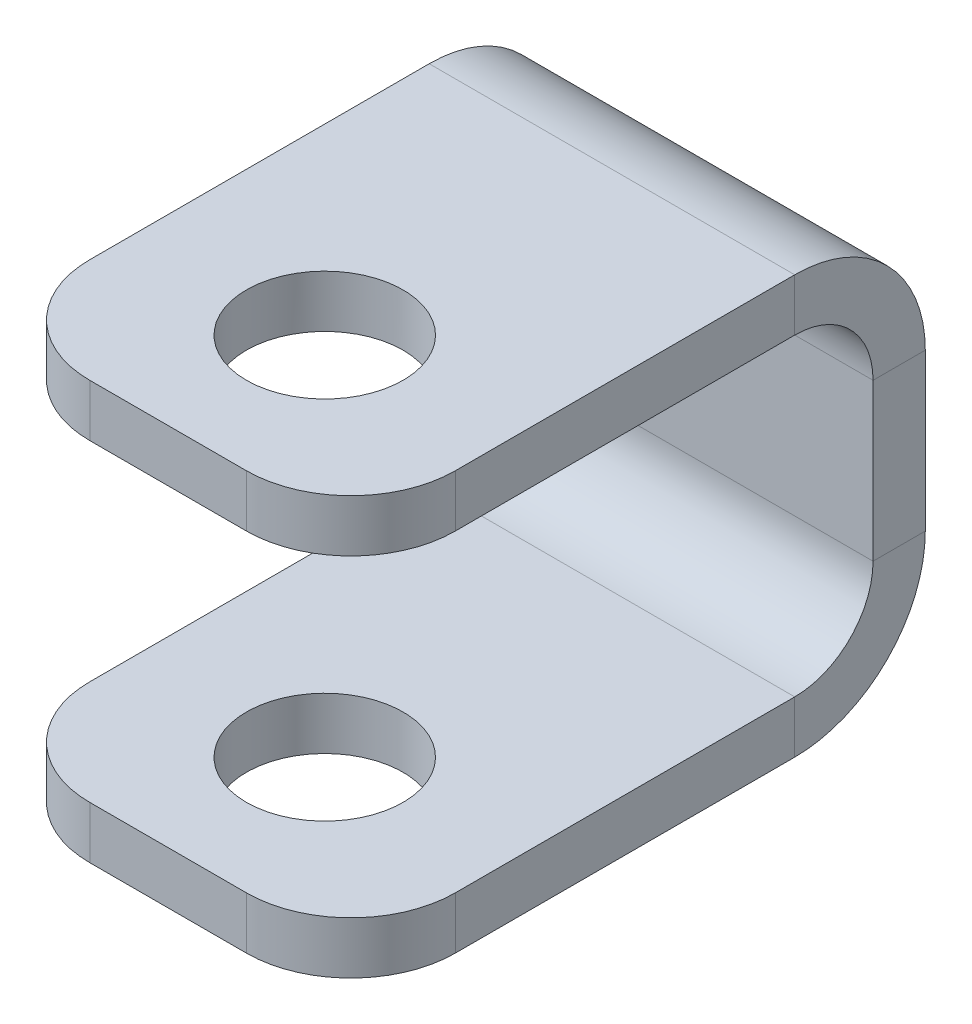
from build123d import *

# Parameters (mm, degrees)
SKETCH12_W                     = 22.225
SKETCH12_H                     = 25.4
BASE_FLANGE2_DEPTH             = 3.175
EDGE_FLANGE2_STRIP_W           = 22.225
EDGE_FLANGE2_STRIP_H           = 3.175
EDGE_FLANGE2_STRIP_CUT_DEPTH   = 22.225
EDGE_FLANGE2_STRIP_2_W         = 22.225
EDGE_FLANGE2_STRIP_2_H         = 3.175
EDGE_FLANGE2_STRIP_CUT_2_DEPTH = 22.225
EDGE_FLANGE2_DEPTH             = 22.225
EDGE_FLANGE2_BEND_DEPTH        = 22.225
CUT_EXTRUDE1_DEPTH             = 53.098064084
CUT_EXTRUDE1_DEPTH_BACK        = 53.098064084
SKETCH23_R                     = 4.7625
BREAK_CORNER1_START            = -12.7
BREAK_CORNER1_DEPTH            = 25.4


# Read off the part's stored shape, not the designer's step: Break-Corner1
# Sheet-metal steps are written as plain solids
with BuildPart() as part:
    # Sketch12 → Base-Flange2 (new body)
    with BuildSketch(Plane.XY):
        with Locations((25.4, 0)):
            Rectangle(SKETCH12_W, SKETCH12_H)
    extrude(amount=BASE_FLANGE2_DEPTH)

    # Edge-Flange2 strip (across the edge) → Edge-Flange2 strip cut (cut)
    with BuildSketch(Plane(origin=(36.5125, 12.7, 3.175), x_dir=(0, -1, 0), z_dir=(-1, 0, 0))):
        with Locations((-3.175, -1.5875)):
            Rectangle(EDGE_FLANGE2_STRIP_W, EDGE_FLANGE2_STRIP_H)
    extrude(amount=EDGE_FLANGE2_STRIP_CUT_DEPTH, mode=Mode.SUBTRACT)

    # Edge-Flange2 strip 2 (across the edge) → Edge-Flange2 strip cut 2 (cut)
    with BuildSketch(Plane(origin=(14.2875, -12.7, 3.175), x_dir=(0, 1, 0), z_dir=(1, 0, 0))):
        with Locations((-3.175, -1.5875)):
            Rectangle(EDGE_FLANGE2_STRIP_2_W, EDGE_FLANGE2_STRIP_2_H)
    extrude(amount=EDGE_FLANGE2_STRIP_CUT_2_DEPTH, mode=Mode.SUBTRACT)

    # Edge-Flange2 section (across the edge) → Edge-Flange2 (add)
    with BuildSketch(Plane(origin=(36.5125, 12.7, 3.175), x_dir=(0, -1, 0), z_dir=(-1, 0, 0))):
        with BuildLine():
            Line((0, 4.7625), (0, 31.75))
            Line((0, 31.75), (3.175, 31.75))
            Line((3.175, 31.75), (3.175, 4.7625))
            ThreePointArc((3.175, 4.7625), (4.569903955, 1.394903955), (7.9375, 0))
            Line((7.9375, 0), (7.9375, -3.175))
            ThreePointArc((7.9375, -3.175), (2.324839924, -0.850160076), (0, 4.7625))
        make_face()
    extrude(amount=EDGE_FLANGE2_DEPTH)

    # Edge-Flange2 section 2 (across the edge) → Edge-Flange2 bend (add)
    with BuildSketch(Plane(origin=(14.2875, -12.7, 3.175), x_dir=(0, 1, 0), z_dir=(1, 0, 0))):
        with BuildLine():
            Line((0, 4.7625), (0, 31.75))
            Line((0, 31.75), (3.175, 31.75))
            Line((3.175, 31.75), (3.175, 4.7625))
            ThreePointArc((3.175, 4.7625), (4.569903955, 1.394903955), (7.9375, 0))
            Line((7.9375, 0), (7.9375, -3.175))
            ThreePointArc((7.9375, -3.175), (2.324839924, -0.850160076), (0, 4.7625))
        make_face()
    extrude(amount=EDGE_FLANGE2_BEND_DEPTH)

    # Sketch23 → Cut-Extrude1 (cut, two sides: drawn at the far end of the back side and taken through both)
    with BuildSketch(Plane(origin=(0, 0, 0), x_dir=(1, 0, 0), z_dir=(0, 1, 0)).offset(-CUT_EXTRUDE1_DEPTH_BACK)):
        with Locations(Location((25.4, -25.4, 0), (0, 0, 270))):
            Circle(SKETCH23_R)
    extrude(amount=CUT_EXTRUDE1_DEPTH + CUT_EXTRUDE1_DEPTH_BACK, mode=Mode.SUBTRACT)

    # Break-Corner1 outline → Break-Corner1 (cut)
    with BuildSketch(Plane(origin=(0, 0, 0), x_dir=(1, 0, 0), z_dir=(0, 1, 0)).offset(BREAK_CORNER1_START)):
        with BuildLine():
            Line((36.5125, -34.925), (36.5125, -28.575))
            ThreePointArc((36.5125, -28.575), (34.652628061, -33.065128061), (30.1625, -34.925))
            Line((30.1625, -34.925), (36.5125, -34.925))
        make_face()
        with BuildLine():
            Line((14.2875, -34.925), (20.6375, -34.925))
            ThreePointArc((20.6375, -34.925), (16.147371939, -33.065128061), (14.2875, -28.575))
            Line((14.2875, -28.575), (14.2875, -34.925))
        make_face()
    extrude(amount=BREAK_CORNER1_DEPTH, mode=Mode.SUBTRACT)


solid = part.part
